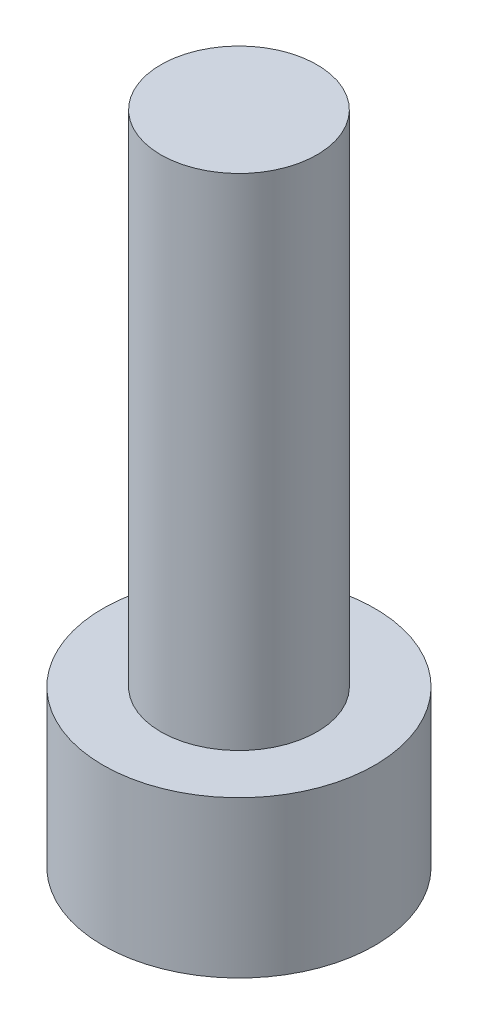
from build123d import *

# Parameters (mm, degrees)
SKETCH_1_R          = 4.35
EXTRUDE_1_DEPTH     = 5
SKETCH_2_R          = 2.5
EXTRUDE_2_DEPTH     = 16
CUT_EXTRUDE_1_DEPTH = 2.5


with BuildPart() as part:
    # 草图1 → 凸台-拉伸1 (new body)
    with BuildSketch(Plane(origin=(0, 0, 0), x_dir=(1, 0, 0), z_dir=(0, 1, 0))):
        Circle(SKETCH_1_R)
    extrude(amount=EXTRUDE_1_DEPTH)

    # 草图2 → 凸台-拉伸2 (add)
    with BuildSketch(Plane(origin=(0, 5, 0), x_dir=(1, 0, 0), z_dir=(0, 1, 0))):
        Circle(SKETCH_2_R)
    extrude(amount=EXTRUDE_2_DEPTH)

    # 草图3 → 切除-拉伸1 (cut)
    with BuildSketch(Plane.XZ):
        Polygon((1.546358871, -1.715257291), (2.258635824, 0.48155742), (0.712276953, 2.196814711), (-1.546358871, 1.715257291), (-2.258635824, -0.48155742), (-0.712276953, -2.196814711), align=None)
    extrude(amount=-CUT_EXTRUDE_1_DEPTH, mode=Mode.SUBTRACT)


solid = part.part
